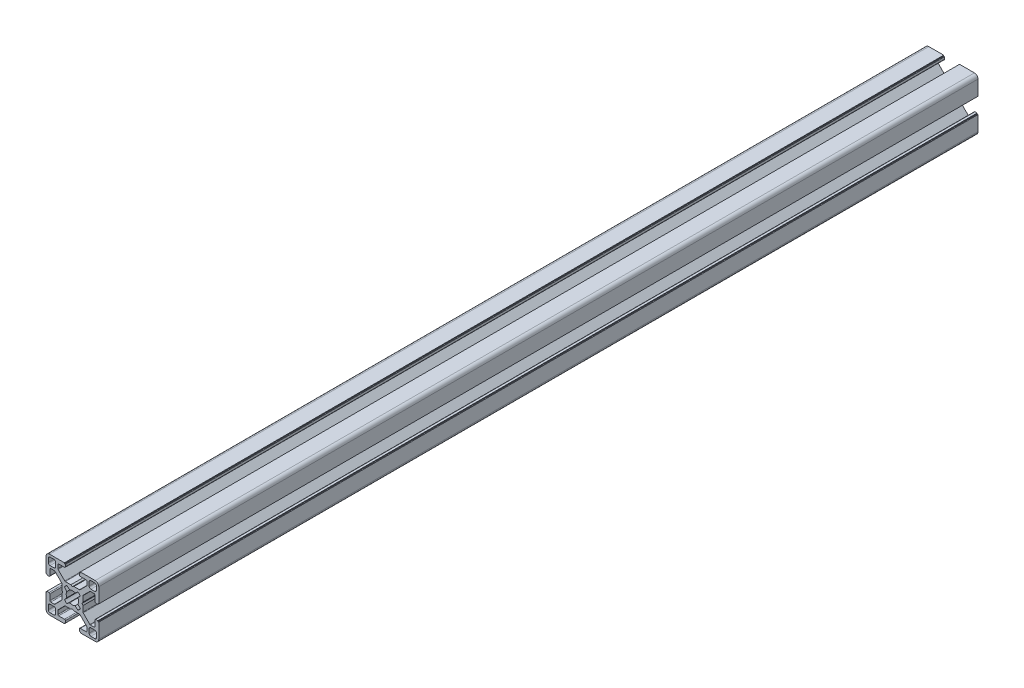
from build123d import *

# Parameters (mm, degrees)
BOSS_EXTRUDE1_DEPTH = 250
CIRPATTERN1_COUNT   = 4


with BuildPart() as part:
    # Sketch3 → Boss-Extrude1 (new, symmetric)
    with BuildSketch(Plane.XY):
        with BuildLine():
            Line((-4.503841895, 3.156803476), (-3.14772708, 1.530298739))
            ThreePointArc((-3.14772708, 1.530298739), (-3.410794979, 0.785160882), (-3.5, 0))
            Line((-3.5, 0), (-5.5, 0))
            Line((-5.5, 0), (-6, 0.866025404))
            Line((-6, 0.866025404), (-6, 3.996841995))
            ThreePointArc((-6, 3.996841995), (-6.038060234, 4.188183711), (-6.146446609, 4.350395385))
            Line((-6.146446609, 4.350395385), (-9.917104615, 8.121053391))
            ThreePointArc((-9.917104615, 8.121053391), (-10.079316289, 8.229439766), (-10.270658005, 8.2675))
            Line((-10.270658005, 8.2675), (-12.29, 8.2675))
            ThreePointArc((-12.29, 8.2675), (-12.643553391, 8.121053391), (-12.79, 7.7675))
            Line((-12.79, 7.7675), (-12.79, 4.5))
            ThreePointArc((-12.79, 4.5), (-12.936446609, 4.146446609), (-13.29, 4))
            Line((-13.29, 4), (-14.5, 4))
            Line((-14.5, 4), (-14.5, 4.5))
            Line((-14.5, 4.5), (-15, 4.5))
            Line((-15, 4.5), (-15, 12.968))
            ThreePointArc((-15, 12.968), (-14.404840979, 14.404840979), (-12.968, 15))
            Line((-12.968, 15), (-4.5, 15))
            Line((-4.5, 15), (-4.5, 14.5))
            Line((-4.5, 14.5), (-4, 14.5))
            Line((-4, 14.5), (-4, 13.29))
            ThreePointArc((-4, 13.29), (-4.146446609, 12.936446609), (-4.5, 12.79))
            Line((-4.5, 12.79), (-7.7675, 12.79))
            ThreePointArc((-7.7675, 12.79), (-8.121053391, 12.643553391), (-8.2675, 12.29))
            Line((-8.2675, 12.29), (-8.2675, 10.270658005))
            ThreePointArc((-8.2675, 10.270658005), (-8.229439766, 10.079316289), (-8.121053391, 9.917104615))
            Line((-8.121053391, 9.917104615), (-4.350395385, 6.146446609))
            ThreePointArc((-4.350395385, 6.146446609), (-4.188183711, 6.038060234), (-3.996841995, 6))
            Line((-3.996841995, 6), (-0.866025404, 6))
            Line((-0.866025404, 6), (0, 5.5))
            Line((0, 5.5), (0, 3.5))
            ThreePointArc((0, 3.5), (-0.785160882, 3.410794979), (-1.530298739, 3.14772708))
            Line((-1.530298739, 3.14772708), (-3.156803476, 4.503841895))
            ThreePointArc((-3.156803476, 4.503841895), (-3.889087297, 3.889087297), (-4.503841895, 3.156803476))
        make_face()
        with BuildLine():
            Line((-12.705, 9.5135), (-10.5135, 9.5135))
            ThreePointArc((-10.5135, 9.5135), (-9.806393219, 9.806393219), (-9.5135, 10.5135))
            Line((-9.5135, 10.5135), (-9.5135, 12.705))
            ThreePointArc((-9.5135, 12.705), (-9.806393219, 13.412106781), (-10.5135, 13.705))
            Line((-10.5135, 13.705), (-12.705, 13.705))
            ThreePointArc((-12.705, 13.705), (-13.412106781, 13.412106781), (-13.705, 12.705))
            Line((-13.705, 12.705), (-13.705, 10.5135))
            ThreePointArc((-13.705, 10.5135), (-13.412106781, 9.806393219), (-12.705, 9.5135))
        make_face(mode=Mode.SUBTRACT)
    boss_extrude1 = extrude(amount=BOSS_EXTRUDE1_DEPTH, both=True)

    # CirPattern1: Boss-Extrude1 ×4 about axis
    cirpattern1_axis = Axis((0, 0, 76.2), (0, 0, -1))
    for i in range(1, CIRPATTERN1_COUNT):
        add(boss_extrude1.rotate(cirpattern1_axis, i * 360 / CIRPATTERN1_COUNT))


solid = part.part
